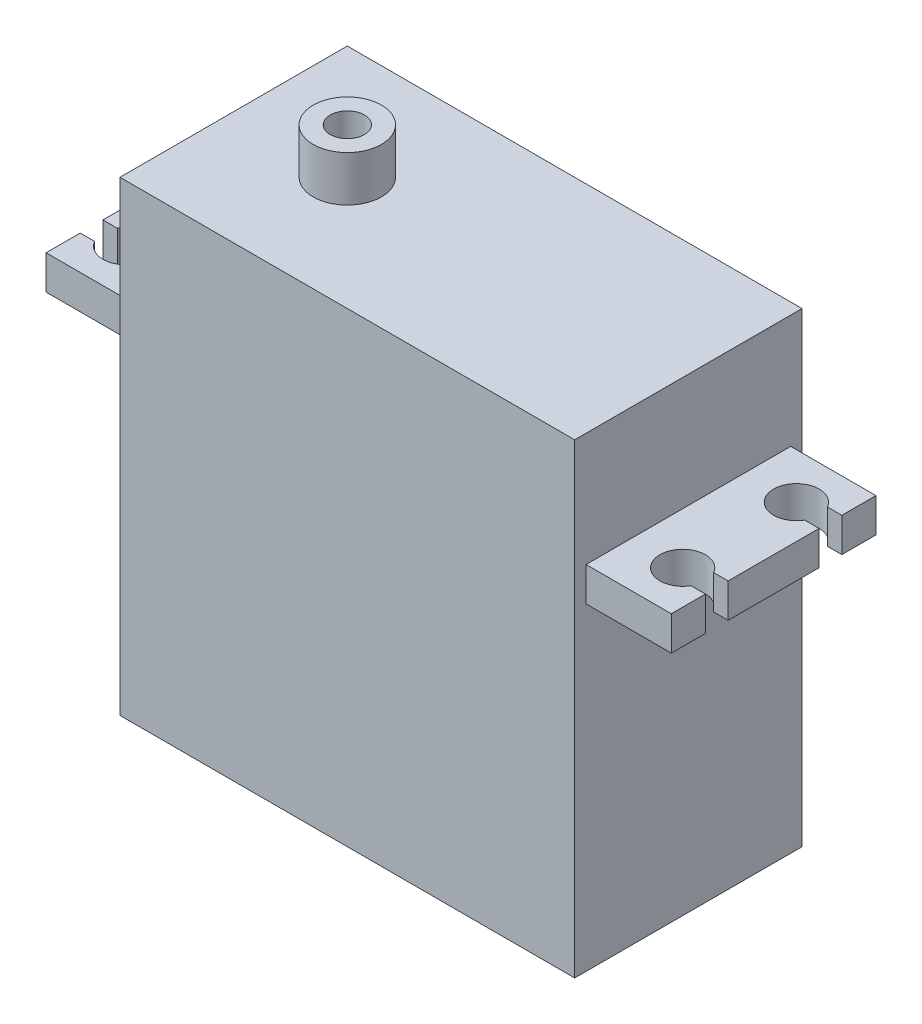
from build123d import *

# Parameters (mm, degrees)
SKETCH1_W             = 40
SKETCH1_H             = 20
BODY_DEPTH            = 41
SKETCH2_W             = 55
SKETCH2_H             = 18
FIN_DEPTH             = 3
HOLE_FOR_SCREWS_REACH = 42.5
SKETCH3_R             = 2
SKETCH4_W             = 7
SKETCH4_H             = 4
WIRE_OUT_DEPTH        = 0.5
SKETCH5_R             = 3
AXLE_DEPTH            = 4
SKETCH6_R             = 1.5
CUT_EXTRUDE1_DEPTH    = 4
CUT_EXTRUDE4_REACH    = 42.5
SKETCH8_W             = 2
SKETCH8_H             = 2


with BuildPart() as part:
    # Sketch1 → Body (new body)
    with BuildSketch(Plane(origin=(0, 0, 0), x_dir=(1, 0, 0), z_dir=(0, 1, 0))):
        Rectangle(SKETCH1_W, SKETCH1_H)
    extrude(amount=BODY_DEPTH)

    # Sketch2 → Fin (add)
    with BuildSketch(Plane(origin=(0, 28, 0), x_dir=(1, 0, 0), z_dir=(0, 1, 0))):
        Rectangle(SKETCH2_W, SKETCH2_H)
    extrude(amount=FIN_DEPTH)

    # Sketch3 → Hole for screws (cut, up to next)
    with BuildSketch(Plane(origin=(0, 28, 0), x_dir=(1, 0, 0), z_dir=(0, 1, 0)), mode=Mode.PRIVATE) as hole_for_screws_sk1:
        with Locations((-24.5, 5)):
            Circle(SKETCH3_R)
    hole_for_screws_tool1 = extrude(hole_for_screws_sk1.sketch, amount=HOLE_FOR_SCREWS_REACH, mode=Mode.PRIVATE) & part.part
    # Sketch3 → Hole for screws (cut, up to next)
    with BuildSketch(Plane(origin=(0, 28, 0), x_dir=(1, 0, 0), z_dir=(0, 1, 0)), mode=Mode.PRIVATE) as hole_for_screws_sk2:
        with Locations((-24.5, -5)):
            Circle(SKETCH3_R)
    hole_for_screws_tool2 = extrude(hole_for_screws_sk2.sketch, amount=HOLE_FOR_SCREWS_REACH, mode=Mode.PRIVATE) & part.part
    # Sketch3 → Hole for screws (cut, up to next)
    with BuildSketch(Plane(origin=(0, 28, 0), x_dir=(1, 0, 0), z_dir=(0, 1, 0)), mode=Mode.PRIVATE) as hole_for_screws_sk3:
        with Locations((24.5, -5)):
            Circle(SKETCH3_R)
    hole_for_screws_tool3 = extrude(hole_for_screws_sk3.sketch, amount=HOLE_FOR_SCREWS_REACH, mode=Mode.PRIVATE) & part.part
    # Sketch3 → Hole for screws (cut, up to next)
    with BuildSketch(Plane(origin=(0, 28, 0), x_dir=(1, 0, 0), z_dir=(0, 1, 0)), mode=Mode.PRIVATE) as hole_for_screws_sk4:
        with Locations((24.5, 5)):
            Circle(SKETCH3_R)
    hole_for_screws_tool4 = extrude(hole_for_screws_sk4.sketch, amount=HOLE_FOR_SCREWS_REACH, mode=Mode.PRIVATE) & part.part
    add(hole_for_screws_tool1.solids().sort_by_distance((-24.5, 28, -5))[0], mode=Mode.SUBTRACT)
    add(hole_for_screws_tool2.solids().sort_by_distance((-24.5, 28, 5))[0], mode=Mode.SUBTRACT)
    add(hole_for_screws_tool3.solids().sort_by_distance((24.5, 28, 5))[0], mode=Mode.SUBTRACT)
    add(hole_for_screws_tool4.solids().sort_by_distance((24.5, 28, -5))[0], mode=Mode.SUBTRACT)

    # Sketch4 → Wire out (add)
    with BuildSketch(Plane.ZY.offset(20)):
        with Locations((0, 5)):
            Rectangle(SKETCH4_W, SKETCH4_H)
    extrude(amount=WIRE_OUT_DEPTH)

    # Sketch5 → Axle (add)
    with BuildSketch(Plane(origin=(0, 41, 0), x_dir=(1, 0, 0), z_dir=(0, 1, 0))):
        with Locations((-10, 0)):
            Circle(SKETCH5_R)
    extrude(amount=AXLE_DEPTH)

    # Sketch6 → Cut-Extrude1 (cut)
    with BuildSketch(Plane(origin=(0, 45, 0), x_dir=(1, 0, 0), z_dir=(0, 1, 0))):
        with Locations((-10, 0)):
            Circle(SKETCH6_R)
    extrude(amount=-CUT_EXTRUDE1_DEPTH, mode=Mode.SUBTRACT)

    # Sketch8 → Cut-Extrude4 (cut, up to next)
    with BuildSketch(Plane(origin=(0, 28, 0), x_dir=(1, 0, 0), z_dir=(0, 1, 0)), mode=Mode.PRIVATE) as cut_extrude4_sk1:
        with Locations((-27, 5)):
            Rectangle(SKETCH8_W, SKETCH8_H)
    cut_extrude4_tool1 = extrude(cut_extrude4_sk1.sketch, amount=CUT_EXTRUDE4_REACH, mode=Mode.PRIVATE) & part.part
    # Sketch8 → Cut-Extrude4 (cut, up to next)
    with BuildSketch(Plane(origin=(0, 28, 0), x_dir=(1, 0, 0), z_dir=(0, 1, 0)), mode=Mode.PRIVATE) as cut_extrude4_sk2:
        with Locations((-27, -5)):
            Rectangle(SKETCH8_W, SKETCH8_H)
    cut_extrude4_tool2 = extrude(cut_extrude4_sk2.sketch, amount=CUT_EXTRUDE4_REACH, mode=Mode.PRIVATE) & part.part
    # Sketch8 → Cut-Extrude4 (cut, up to next)
    with BuildSketch(Plane(origin=(0, 28, 0), x_dir=(1, 0, 0), z_dir=(0, 1, 0)), mode=Mode.PRIVATE) as cut_extrude4_sk3:
        with Locations((27, -5)):
            Rectangle(SKETCH8_W, SKETCH8_H)
    cut_extrude4_tool3 = extrude(cut_extrude4_sk3.sketch, amount=CUT_EXTRUDE4_REACH, mode=Mode.PRIVATE) & part.part
    # Sketch8 → Cut-Extrude4 (cut, up to next)
    with BuildSketch(Plane(origin=(0, 28, 0), x_dir=(1, 0, 0), z_dir=(0, 1, 0)), mode=Mode.PRIVATE) as cut_extrude4_sk4:
        with Locations((27, 5)):
            Rectangle(SKETCH8_W, SKETCH8_H)
    cut_extrude4_tool4 = extrude(cut_extrude4_sk4.sketch, amount=CUT_EXTRUDE4_REACH, mode=Mode.PRIVATE) & part.part
    add(cut_extrude4_tool1.solids().sort_by_distance((-27, 28, -5))[0], mode=Mode.SUBTRACT)
    add(cut_extrude4_tool2.solids().sort_by_distance((-27, 28, 5))[0], mode=Mode.SUBTRACT)
    add(cut_extrude4_tool3.solids().sort_by_distance((27, 28, 5))[0], mode=Mode.SUBTRACT)
    add(cut_extrude4_tool4.solids().sort_by_distance((27, 28, -5))[0], mode=Mode.SUBTRACT)


solid = part.part
